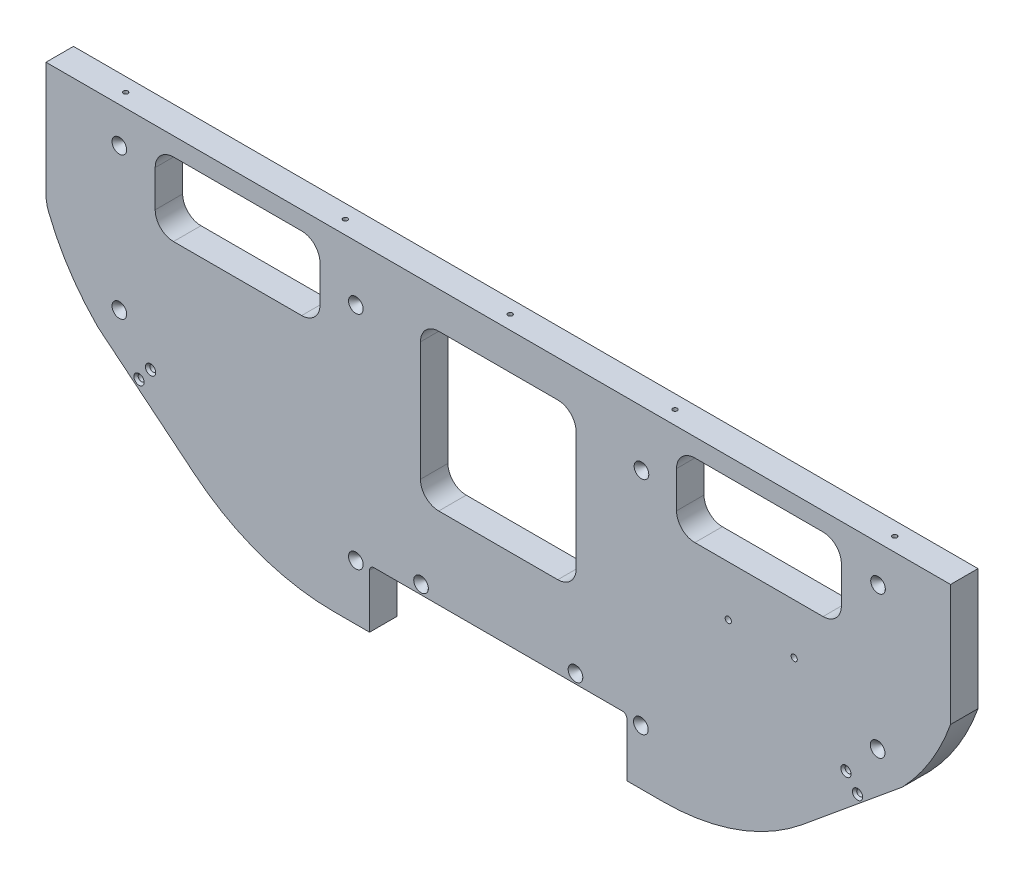
from build123d import *

# Parameters (mm, degrees)
BOSS_EXTRUDE1_DEPTH                               = 19.05
F_5_64_0_07813_DIAMETER_HOLE1_D                   = 3.175
F_5_64_0_07813_DIAMETER_HOLE1_DEPTH               = 38.1
F_5_64_0_07813_DIAMETER_HOLE1_CSINK_D             = 10.16
F_5_64_0_07813_DIAMETER_HOLE1_CSINK_ANGLE         = 82
F_5_64_0_07813_DIAMETER_HOLE1_TIP                 = 0.953866233
F_5_64_0_07813_DIAMETER_HOLE2_D                   = 1.984502
F_5_64_0_07813_DIAMETER_HOLE2_DEPTH               = 38.1
F_5_64_0_07813_DIAMETER_HOLE2_CSINK_D             = 10.16
F_5_64_0_07813_DIAMETER_HOLE2_CSINK_ANGLE         = 82
F_5_64_0_07813_DIAMETER_HOLE2_TIP                 = 0.59620455
CUT_EXTRUDE1_REACH                                = 1050.231
SKETCH6_W                                         = 178.5366
SKETCH6_H                                         = 40.3225
FILLET1_R                                         = 25.4
F_6_CLEARANCE_HOLE1_D                             = 4.3053
CSK_FOR_6_FLAT_HEAD_MACHINE_SCREW_100_D           = 4.3053
CSK_FOR_6_FLAT_HEAD_MACHINE_SCREW_100_CSINK_D     = 7.0866
CSK_FOR_6_FLAT_HEAD_MACHINE_SCREW_100_CSINK_ANGLE = 82
SKETCH12_W                                        = 114.3
SKETCH12_H                                        = 50.8
SKETCH12_W_2                                      = 107.95
SKETCH12_H_2                                      = 107.95
CUT_EXTRUDE2_DEPTH                                = 1049.23059488
FILLET2_R                                         = 12.7
FILLET3_R                                         = 3.175


with BuildPart() as part:
    # Sketch1 → Boss-Extrude1 (new body)
    with BuildSketch(Plane.XY):
        with BuildLine():
            Line((-394.36675, -87.3125), (-394.36675, -3.175))
            Line((-394.36675, -3.175), (-709.32675, -3.175))
            Line((-709.32675, -3.175), (-1021.74675, -3.175))
            Line((-1021.74675, -3.175), (-1021.74675, -87.3125))
            ThreePointArc((-1021.74675, -87.3125), (-1006.860273511, -117.921148224), (-985.55175, -144.4625))
            Line((-985.55175, -144.4625), (-918.739071633, -199.014217805))
            ThreePointArc((-918.739071633, -199.014217805), (-873.516686506, -224.518833531), (-822.35675, -233.3625))
            Line((-822.35675, -233.3625), (-709.32675, -233.3625))
            Line((-709.32675, -233.3625), (-593.75675, -233.3625))
            ThreePointArc((-593.75675, -233.3625), (-542.596813494, -224.518833531), (-497.374428367, -199.014217805))
            Line((-497.374428367, -199.014217805), (-427.75505, -141.598056338))
            ThreePointArc((-427.75505, -141.598056338), (-408.191508181, -116.220095946), (-394.36675, -87.3125))
        make_face()
    extrude(amount=BOSS_EXTRUDE1_DEPTH)

    # 5/64 (0.07813) Diameter Hole1
    with Locations(Plane(origin=(-708.05675, 15.875, 6128.559863233), x_dir=(1, 0, 0), z_dir=(0, 1, 0))):
        with Locations((-262.8265, 6157.452363233), (-98.7933, 6157.452363233), (-262.8265, 6233.652363233), (-98.7933, 6233.652363233), (-262.8265, 6309.852363233), (-98.7933, 6309.852363233), (-267.97, 6119.034863233), (-115.57, 6119.034863233), (-1.27, 6119.034863233), (113.03, 6119.034863233), (265.43, 6119.034863233), (96.2533, 6309.852363233), (260.2865, 6309.852363233), (96.2533, 6233.652363233), (260.2865, 6233.652363233), (96.2533, 6157.452363233), (260.2865, 6157.452363233)):
            CounterSinkHole(F_5_64_0_07813_DIAMETER_HOLE1_D / 2, F_5_64_0_07813_DIAMETER_HOLE1_CSINK_D / 2, depth=F_5_64_0_07813_DIAMETER_HOLE1_DEPTH, counter_sink_angle=F_5_64_0_07813_DIAMETER_HOLE1_CSINK_ANGLE)
            with Locations((0, 0, -(F_5_64_0_07813_DIAMETER_HOLE1_DEPTH + F_5_64_0_07813_DIAMETER_HOLE1_TIP / 2))):  # 118° drill point
                Cone(0, F_5_64_0_07813_DIAMETER_HOLE1_D / 2, F_5_64_0_07813_DIAMETER_HOLE1_TIP, mode=Mode.SUBTRACT)

    # 5/64 (0.07813) Diameter Hole2
    with Locations(Plane(origin=(-708.05675, 1936.853954382, 19.05), x_dir=(-1, 0, 0), z_dir=(0, 0, 1))):
        with Locations((-263.392416364, 1965.434682144), (262.8265, 1964.708862949), (262.8265, 2063.428497217), (98.7933, 2131.851871048), (98.7933, 1978.393537715), (53.56098, 2123.543954382), (-53.56098, 2123.543954382), (-99.322089753, 1978.666800322), (-98.898757225, 2132.124549748), (-263.120086856, 2064.153940785)):
            CounterSinkHole(F_5_64_0_07813_DIAMETER_HOLE2_D / 2, F_5_64_0_07813_DIAMETER_HOLE2_CSINK_D / 2, depth=F_5_64_0_07813_DIAMETER_HOLE2_DEPTH, counter_sink_angle=F_5_64_0_07813_DIAMETER_HOLE2_CSINK_ANGLE)
            with Locations((0, 0, -(F_5_64_0_07813_DIAMETER_HOLE2_DEPTH + F_5_64_0_07813_DIAMETER_HOLE2_TIP / 2))):  # 118° drill point
                Cone(0, F_5_64_0_07813_DIAMETER_HOLE2_D / 2, F_5_64_0_07813_DIAMETER_HOLE2_TIP, mode=Mode.SUBTRACT)

    # Sketch6 → Cut-Extrude1 (cut, up to next)
    with BuildSketch(Plane(origin=(0, 0, 0), x_dir=(-1, 0, 0), z_dir=(0, 0, -1)), mode=Mode.PRIVATE) as cut_extrude1_sk1:
        with Locations((708.05675, -213.20125)):
            Rectangle(SKETCH6_W, SKETCH6_H)
    cut_extrude1_tool1 = extrude(cut_extrude1_sk1.sketch, amount=-CUT_EXTRUDE1_REACH, mode=Mode.PRIVATE) & part.part
    add(cut_extrude1_tool1.solids().sort_by_distance((-708.05675, -213.20125, 0))[0], mode=Mode.SUBTRACT)

    # Fillet1
    # the kernel refuses this fillet: 25.4 mm, written as the material it takes off along each edge
    with BuildSketch(Plane(origin=(-985.55175, -144.4625, -3.556364323), x_dir=(0.774600109100918, -0.6324513190600886, 0), z_dir=(0, 0, 1))) as fillet1_piece_1:
        with BuildLine():
            CenterArc((1.298600642, 25.4), FILLET1_R, 263.866898569, 6.133101431)
            ThreePointArc((-1.415097548, 0.145379786), (-0.707718402, 0.071038768), (0, 0))
            Line((0, 0), (1.298600642, 0))
        make_face()
    extrude(amount=26.162728647, mode=Mode.SUBTRACT)
    with BuildSketch(Plane(origin=(-1021.74675, -87.3125, -12.530817302), x_dir=(0.3496618051850599, -0.9368759907238126, 0), z_dir=(0, 0, 1))) as fillet1_piece_2:
        with BuildLine():
            CenterArc((4.594633011, 25.396565354), FILLET1_R, 249.53336899, 21.408882071)
            Line((-4.286776841, 1.59991519), (0, 0))
            ThreePointArc((0, 0), (2.50616346, -0.020607874), (5.012326921, 0))
        make_face()
    extrude(amount=44.111634604, mode=Mode.SUBTRACT)

    # #6 Clearance Hole1 (through all)
    with Locations(Plane.XY.offset(19.05)):
        with Locations((-502.79935, -101.470451403), (-548.51935, -101.470451403)):
            Hole(F_6_CLEARANCE_HOLE1_D / 2)

    # CSK for #6 Flat Head Machine Screw (100)1 (through all)
    with Locations(Plane.XY.offset(19.05)):
        with Locations((-957.238157022, -161.431861444), (-949.20602527, -151.594440059), (-466.905224793, -151.592363566), (-458.873093041, -161.429784952)):
            CounterSinkHole(CSK_FOR_6_FLAT_HEAD_MACHINE_SCREW_100_D / 2, CSK_FOR_6_FLAT_HEAD_MACHINE_SCREW_100_CSINK_D / 2, counter_sink_angle=CSK_FOR_6_FLAT_HEAD_MACHINE_SCREW_100_CSINK_ANGLE)

    # Sketch12 → Cut-Extrude2 (cut, through all)
    with BuildSketch(Plane.XY.offset(19.05)):
        with Locations((-527.24685, -41.275)):
            Rectangle(SKETCH12_W, SKETCH12_H)
        with Locations((-888.86665, -41.275)):
            Rectangle(SKETCH12_W, SKETCH12_H)
        with Locations((-708.05675, -82.55)):
            Rectangle(SKETCH12_W_2, SKETCH12_H_2)
    extrude(amount=-CUT_EXTRUDE2_DEPTH, mode=Mode.SUBTRACT)

    # Fillet2
    fillet2_edges = [part.edges().sort_by_distance(p)[0] for p in [
        (-584.39685, -66.675, 9.525),
        (-584.39685, -15.875, 9.525),
        (-470.09685, -15.875, 9.525),
        (-470.09685, -66.675, 9.525),
        (-946.01665, -66.675, 9.525),
        (-946.01665, -15.875, 9.525),
        (-831.71665, -15.875, 9.525),
        (-831.71665, -66.675, 9.525),
        (-762.03175, -136.525, 9.525),
        (-762.03175, -28.575, 9.525),
        (-654.08175, -28.575, 9.525),
        (-654.08175, -136.525, 9.525),
    ]]
    fillet(fillet2_edges, radius=FILLET2_R)

    # Fillet3
    fillet3_edges = [part.edges().sort_by_distance(p)[0] for p in [
        (-797.32505, -193.04, 9.525),
        (-618.78845, -193.04, 9.525),
    ]]
    fillet(fillet3_edges, radius=FILLET3_R)


solid = part.part
